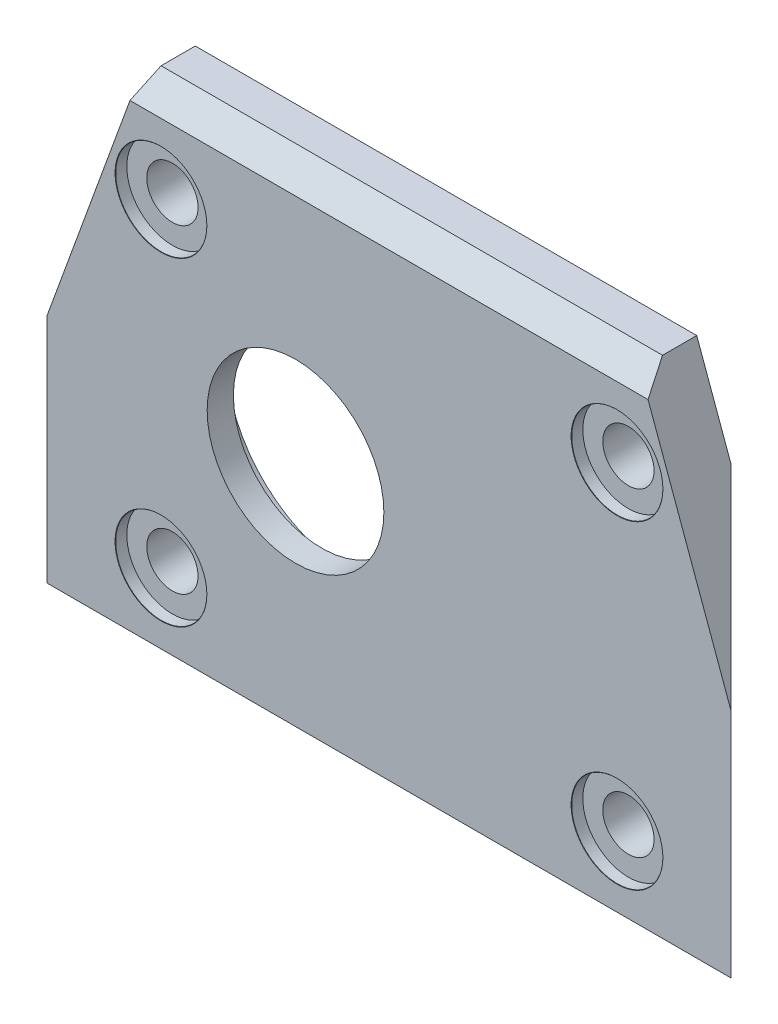
from build123d import *
from OCP.BRepFilletAPI import BRepFilletAPI_MakeChamfer

# Parameters (mm, degrees)
SKETCH2_W                                    = 60
SKETCH2_H                                    = 44.3
SKETCH2_R                                    = 2.25
SKETCH2_R_2                                  = 7.75
BOSS_EXTRUDE1_DEPTH                          = 5
CBORE_FOR_M4_HEX_SOCKET_HEAD_CAP_SCR_2_COUNT = 2
CBORE_FOR_M4_HEX_SOCKET_HEAD_CAP_SCR_2_PITCH = 40
CBORE_FOR_M4_HEX_SOCKET_HEAD_CAP_SCR_3_COUNT = 2
CBORE_FOR_M4_HEX_SOCKET_HEAD_CAP_SCR_3_PITCH = 48.826222463
CBORE_FOR_M4_HEX_SOCKET_HEAD_CAP_SCR_4_COUNT = 2
CBORE_FOR_M4_HEX_SOCKET_HEAD_CAP_SCR_4_PITCH = 28
SKETCH7_R                                    = 11.1
CUT_EXTRUDE1_DEPTH                           = 2.7
CHAMFER2_SIZE                                = 22
CHAMFER2_SIZE2                               = 8.007345154
CHAMFER3_SIZE                                = 2
CHAMFER1_SIZE                                = 5


with BuildPart() as part:
    # Sketch2 → Boss-Extrude1 (new body)
    with BuildSketch(Plane.XY):
        Rectangle(SKETCH2_W, SKETCH2_H)
        with Locations((-20, 14)):
            Circle(SKETCH2_R, mode=Mode.SUBTRACT)
        with Locations((-20, -14)):
            Circle(SKETCH2_R, mode=Mode.SUBTRACT)
        with Locations((20, 14)):
            Circle(SKETCH2_R, mode=Mode.SUBTRACT)
        with Locations((20, -14)):
            Circle(SKETCH2_R, mode=Mode.SUBTRACT)
        with Locations((-8.2, 0)):
            Circle(SKETCH2_R_2, mode=Mode.SUBTRACT)
    extrude(amount=BOSS_EXTRUDE1_DEPTH)

    # Sketch4 → CBORE for M4 Hex Socket Head Cap Screw1 (revolve, cut)
    with BuildSketch(Plane(origin=(-20, 14, 5), x_dir=(0, -1, 0), z_dir=(1, 0, 0))):
        Polygon((0, 0), (0, 5), (2.25, 5), (2.25, 1), (4, 1), (4, 0.025), (4.025, 0), align=None)
    cbore_for_m4_hex_socket_head_cap_screw1 = revolve(axis=Axis((-20, 14, 11.35), (0, 0, -1)), mode=Mode.SUBTRACT)

    # CBORE for M4 Hex Socket Head Cap Scr 2: CBORE for M4 Hex Socket Head Cap Screw1 ×2
    with Locations(*[(i * CBORE_FOR_M4_HEX_SOCKET_HEAD_CAP_SCR_2_PITCH, 0, 0) for i in range(1, CBORE_FOR_M4_HEX_SOCKET_HEAD_CAP_SCR_2_COUNT)]):
        add(cbore_for_m4_hex_socket_head_cap_screw1, mode=Mode.SUBTRACT)

    # CBORE for M4 Hex Socket Head Cap Scr 3: CBORE for M4 Hex Socket Head Cap Screw1 ×2
    with Locations(*[Vector(0.8192319205190405, -0.5734623443633283, 0) * (i * CBORE_FOR_M4_HEX_SOCKET_HEAD_CAP_SCR_3_PITCH) for i in range(1, CBORE_FOR_M4_HEX_SOCKET_HEAD_CAP_SCR_3_COUNT)]):
        add(cbore_for_m4_hex_socket_head_cap_screw1, mode=Mode.SUBTRACT)

    # CBORE for M4 Hex Socket Head Cap Scr 4: CBORE for M4 Hex Socket Head Cap Screw1 ×2
    with Locations(*[(0, -i * CBORE_FOR_M4_HEX_SOCKET_HEAD_CAP_SCR_4_PITCH, 0) for i in range(1, CBORE_FOR_M4_HEX_SOCKET_HEAD_CAP_SCR_4_COUNT)]):
        add(cbore_for_m4_hex_socket_head_cap_screw1, mode=Mode.SUBTRACT)

    # Sketch7 → Cut-Extrude1 (cut)
    with BuildSketch(Plane(origin=(0, 0, 0), x_dir=(-1, 0, 0), z_dir=(0, 0, -1))):
        with Locations((8.2, 0)):
            Circle(SKETCH7_R)
    extrude(amount=-CUT_EXTRUDE1_DEPTH, mode=Mode.SUBTRACT)

    # Chamfer2: one chamfer whose edges measure the first distance from different faces: ONE call of the kernel's chamfer builder (chamfer() names one face for all edges)
    chamfer2_edges_1 = [part.edges().sort_by_distance(p)[0] for p in [
        (-30, 22.15, 2.5),
    ]]
    chamfer2_side_1 = [part.faces().sort_by_distance(p)[0] for p in [
        (-30, 0, 2.5),
    ]]
    chamfer2_edges_2 = [part.edges().sort_by_distance(p)[0] for p in [
        (30, 22.15, 2.5),
    ]]
    chamfer2_side_2 = [part.faces().sort_by_distance(p)[0] for p in [
        (30, 0, 2.5),
    ]]
    chamfer2 = BRepFilletAPI_MakeChamfer(part.part.solid().wrapped)
    for e in chamfer2_edges_1:
        chamfer2.Add(CHAMFER2_SIZE, CHAMFER2_SIZE2, e.wrapped, chamfer2_side_1[0].wrapped)  # the first distance lies on this face
    for e in chamfer2_edges_2:
        chamfer2.Add(CHAMFER2_SIZE, CHAMFER2_SIZE2, e.wrapped, chamfer2_side_2[0].wrapped)  # the first distance lies on this face
    add(Compound.cast(chamfer2.Shape()), mode=Mode.REPLACE)

    # Chamfer3
    chamfer3_edges = [part.edges().sort_by_distance(p)[0] for p in [
        (0, -22.15, 5),
        (0, 22.15, 5),
    ]]
    chamfer(chamfer3_edges, length=CHAMFER3_SIZE)

    # Chamfer1
    chamfer1_edges = [part.edges().sort_by_distance(p)[0] for p in [
        (-30, -11, 0),
        (30, -11, 0),
    ]]
    chamfer(chamfer1_edges, length=CHAMFER1_SIZE - 0.0001)  # a hair under: the kernel refuses the full size


solid = part.part
